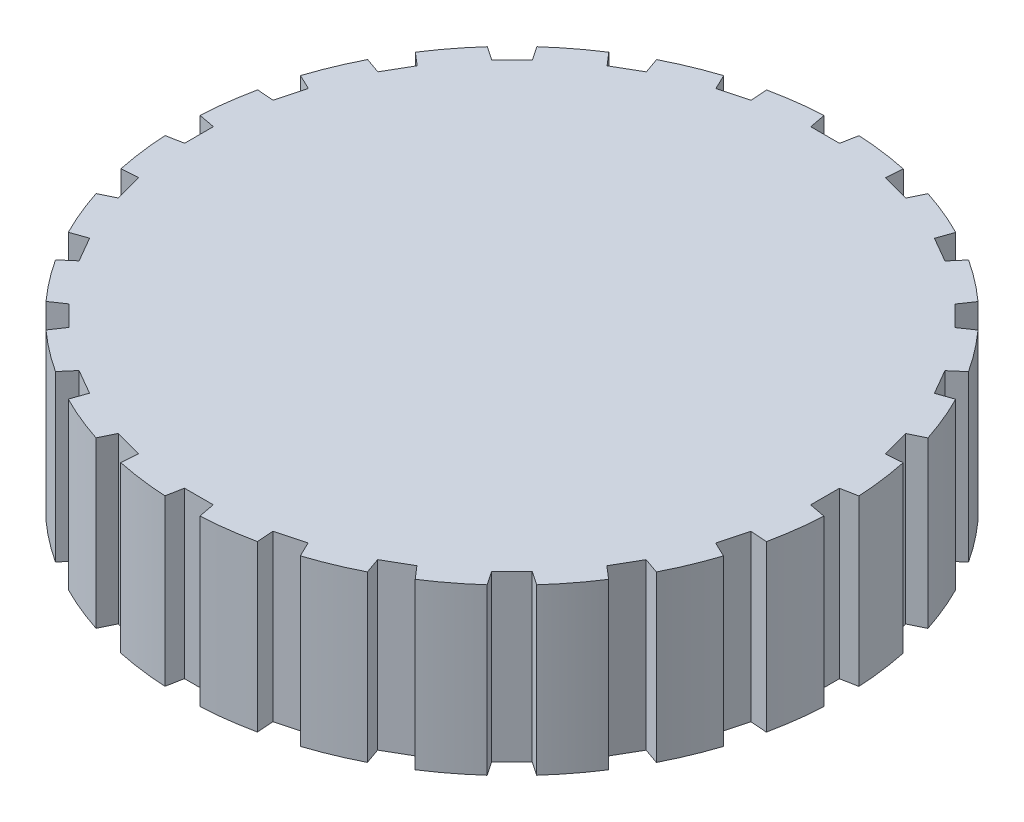
from build123d import *

# Parameters (mm, degrees)
SKETCH5_R           = 38.1
BOSS_EXTRUDE2_DEPTH = 19.05
CUT_EXTRUDE1_DEPTH  = 22.05
CIRPATTERN1_COUNT   = 24


with BuildPart() as part:
    # Sketch5 → Boss-Extrude2 (new body)
    with BuildSketch(Plane(origin=(0, 0, 0), x_dir=(1, 0, 0), z_dir=(0, 1, 0))):
        Circle(SKETCH5_R)
    extrude(amount=BOSS_EXTRUDE2_DEPTH)

    # Sketch8 → Cut-Extrude1 (cut)
    with BuildSketch(Plane(origin=(0, 19.05, 0), x_dir=(1, 0, 0), z_dir=(0, 1, 0))):
        Polygon((0, 38.1), (2.038760384, 38.1), (1.668891127, 36.15), (0.008891127, 36.15), (-1.651108873, 36.15), (-2.02097813, 38.1), align=None)
    cut_extrude1 = extrude(amount=-CUT_EXTRUDE1_DEPTH, mode=Mode.SUBTRACT)

    # CirPattern1: Cut-Extrude1 ×24 about axis
    cirpattern1_axis = Axis((0, 19.05, 0), (0, 1, 0))
    for i in range(1, CIRPATTERN1_COUNT):
        add(cut_extrude1.rotate(cirpattern1_axis, i * 360 / CIRPATTERN1_COUNT), mode=Mode.SUBTRACT)


solid = part.part
